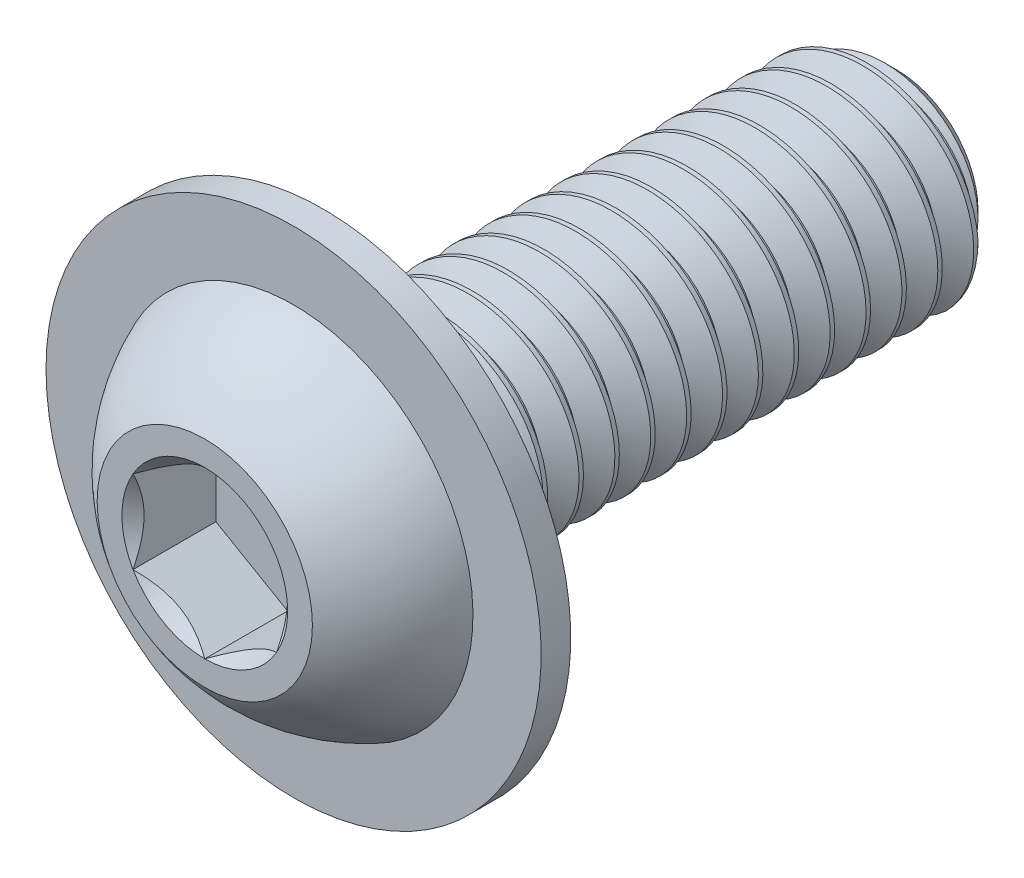
from build123d import *

# Parameters (mm, degrees)
SKETCH1_W           = 8
SKETCH1_H           = 1.5
CHAMFER1_SIZE       = 0.375
CUT_SWEEP1_PITCH    = 0.5
SKETCH11_R          = 3.45
BOSS_EXTRUDE3_DEPTH = 0.4125
CUT_EXTRUDE2_DEPTH  = 1.155


with BuildPart() as part:
    # Sketch1 → Revolve1 (revolve)
    with BuildSketch(Plane(origin=(0, 0, 0), x_dir=(0, 0, -1), z_dir=(1, 0, 0))):
        with Locations((5.65, 0.75)):
            Rectangle(SKETCH1_W, SKETCH1_H)
    revolve(axis=Axis((0, 0, -9.65), (0, 0, 1)))

    # Chamfer1
    chamfer1_edges = [part.edges().sort_by_distance(p)[0] for p in [
        (0, -1.5, -9.65),
    ]]
    chamfer(chamfer1_edges, length=CHAMFER1_SIZE)

    # Cut-Sweep1: arcs per turn and ends read off the stored shape
    # Cut-Sweep1: the profile of Sketch2 profile screwed along a right-hand helix through 17 turns, 6 arcs to a turn; built about Z, then put on its axis
    cut_sweep1_z = Axis((0, 0, 0), (0, 0, 1))
    cut_sweep1_corners = [(1.5003, 0, 0.000173205), (1.5003, 0, -0.437673205), (1.175240474, 0, -0.25), (1.175240474, 0, -0.1875)]
    with BuildLine(mode=Mode.PRIVATE) as cut_sweep1_profile:
        Line(cut_sweep1_corners[0], cut_sweep1_corners[1])
        Line(cut_sweep1_corners[1], cut_sweep1_corners[2])
        Line(cut_sweep1_corners[2], cut_sweep1_corners[3])
        Line(cut_sweep1_corners[3], cut_sweep1_corners[0])
    cut_sweep1_cap = Face(cut_sweep1_profile.wire())
    cut_sweep1_turn_angles = [0, 30, 60, 90, 120, 150, 180, 210, 240, 270, 300, 330, 360]
    cut_sweep1_turn_weights = [1, 0.8660254037844387, 1, 0.8660254037844387, 1, 0.8660254037844387, 1, 0.8660254037844387, 1, 0.8660254037844387, 1, 0.8660254037844387, 1]
    cut_sweep1_turn_rails = [Edge.make_bspline([Vector(p[0], p[1], 0).rotate(cut_sweep1_z, cut_sweep1_turn_angles[k]) / cut_sweep1_turn_weights[k] + Vector(0, 0, p[2] + CUT_SWEEP1_PITCH * cut_sweep1_turn_angles[k] / 360) for k in range(13)], [0, 0, 0, 1, 1, 2, 2, 3, 3, 4, 4, 5, 5, 6, 6, 6], 2, cut_sweep1_turn_weights) for p in cut_sweep1_corners]
    cut_sweep1_turn_sides = [Face.make_surface_from_curves(cut_sweep1_turn_rails[p[0]], cut_sweep1_turn_rails[p[1]]) for p in [(0, 1), (1, 2), (2, 3), (3, 0)]]
    cut_sweep1 = Plane(origin=(0, 0, -9.65), x_dir=(0, 1, 0), z_dir=(0, 0, 1)) * Solid(Shell([*[p.moved(Location((0, 0, CUT_SWEEP1_PITCH * i))) for i in range(17) for p in cut_sweep1_turn_sides], cut_sweep1_cap, cut_sweep1_cap.rotate(cut_sweep1_z, 6120).moved(Location((0, 0, CUT_SWEEP1_PITCH * 6120 / 360)))]))
    add(cut_sweep1, mode=Mode.SUBTRACT)

    # Sketch7 → Revolve2 (revolve)
    with BuildSketch(Plane(origin=(0, 0, 0), x_dir=(0, 0, -1), z_dir=(1, 0, 0)), mode=Mode.PRIVATE) as revolve2_sk:
        with BuildLine():
            Line((1.2375, 2.5), (1.65, 2.5))
            Line((1.65, 2.5), (1.65, 0))
            Line((1.65, 0), (0, 0))
            Line((0, 0), (0, 1.5))
            ThreePointArc((0, 1.5), (0.543173348, 2.093526107), (1.2375, 2.5))
        make_face()
    revolve(revolve2_sk.sketch.rotate(Axis((0, 0, 0), (0, 0, -1)), 189.336081704), axis=Axis((0, 0, 0), (0, 0, -1)))

    # Sketch11 → Boss-Extrude3 (add)
    with BuildSketch(Plane(origin=(0, 0, -1.65), x_dir=(-1, 0, 0), z_dir=(0, 0, -1))):
        Circle(SKETCH11_R)
    extrude(amount=-BOSS_EXTRUDE3_DEPTH)

    # Sketch5 → Cut-Extrude2 (cut)
    with BuildSketch(Plane.XY):
        Polygon((1, -0.577350269), (1, 0.577350269), (0, 1.154700538), (-1, 0.577350269), (-1, -0.577350269), (0, -1.154700538), align=None)
    extrude(amount=-CUT_EXTRUDE2_DEPTH, mode=Mode.SUBTRACT)

    # Cut-Extrude3 cone 1 section (through the dimple's axis) → Cut-Extrude3 (revolve, cut)
    with BuildSketch(Plane(origin=(0, 0, 0), x_dir=(0, -1, 0), z_dir=(1, 0, 0))):
        Polygon((0, 0), (1.154700538, 0), (0, 1.154700538), align=None)
    revolve(axis=Axis((0, 0, 0), (0, 0, -1)), mode=Mode.SUBTRACT)


solid = part.part
